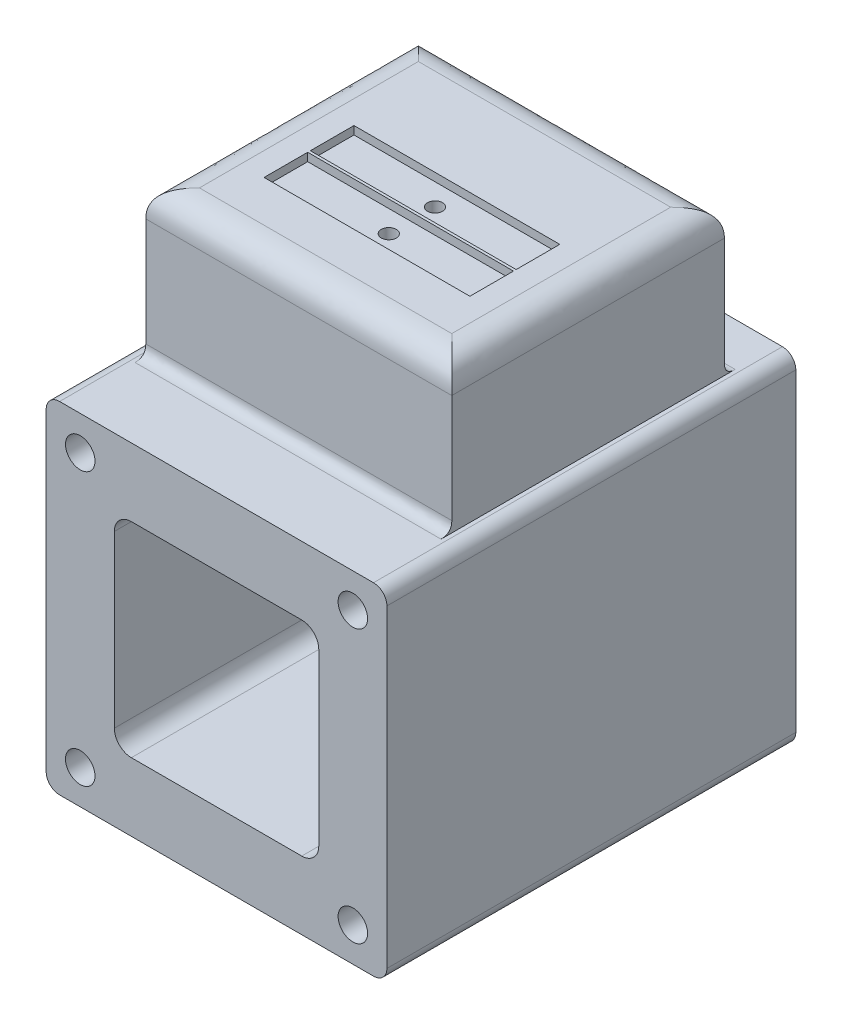
from build123d import *

# Parameters (mm, degrees)
SKETCH1_W                = 63.5
SKETCH1_H                = 63.5
BOSS_EXTRUDE1_DEPTH      = 76.2
M5_CLEARANCE_HOLE1_D     = 5.5
SKETCH4_W                = 38.1
SKETCH4_H                = 38.1
CUT_EXTRUDE1_DEPTH       = 89.44526556
FILLET1_R                = 2.5
FILLET2_R                = 3.175
SKETCH5_W                = 57.027431562
SKETCH5_H                = 50.8
BOSS_EXTRUDE2_DEPTH      = 27.178
SKETCH7_W                = 38.354
SKETCH7_H                = 8.128
CUT_EXTRUDE2_DEPTH       = 1.524
M3_CLEARANCE_HOLE1_D     = 2.8
M3_CLEARANCE_HOLE1_DEPTH = 38.354
FILLET3_SIZE             = 5
FILLET4_SIZE             = 2
FILLET5_SIZE             = 2


with BuildPart() as part:
    # Sketch1 → Boss-Extrude1 (new body)
    with BuildSketch(Plane.XY):
        Rectangle(SKETCH1_W, SKETCH1_H)
    extrude(amount=BOSS_EXTRUDE1_DEPTH)

    # M5 Clearance Hole1 (through all)
    with Locations(Plane.XY.offset(76.2)):
        with Locations((25.4, -25.4), (25.4, 25.4), (-25.4, -25.4), (-25.4, 25.4)):
            Hole(M5_CLEARANCE_HOLE1_D / 2)

    # Sketch4 → Cut-Extrude1 (cut, through all)
    with BuildSketch(Plane(origin=(0, 0, 0), x_dir=(-1, 0, 0), z_dir=(0, 0, -1))):
        Rectangle(SKETCH4_W, SKETCH4_H)
    extrude(amount=-CUT_EXTRUDE1_DEPTH, mode=Mode.SUBTRACT)

    # Fillet1
    fillet1_edges = [part.edges().sort_by_distance(p)[0] for p in [
        (31.75, -31.75, 38.1),
        (-31.75, -31.75, 38.1),
        (-31.75, 31.75, 38.1),
        (31.75, 31.75, 38.1),
    ]]
    fillet(fillet1_edges, radius=FILLET1_R)

    # Fillet2
    fillet2_edges = [part.edges().sort_by_distance(p)[0] for p in [
        (19.05, -19.05, 38.1),
        (19.05, 19.05, 38.1),
        (-19.05, 19.05, 38.1),
        (-19.05, -19.05, 38.1),
    ]]
    fillet(fillet2_edges, radius=FILLET2_R)

    # Sketch5 → Boss-Extrude2 (add)
    with BuildSketch(Plane(origin=(0, 31.75, 0), x_dir=(1, 0, 0), z_dir=(0, 1, 0))):
        with Locations((0, -35.47764662)):
            Rectangle(SKETCH5_W, SKETCH5_H)
    extrude(amount=BOSS_EXTRUDE2_DEPTH)

    # Sketch7 → Cut-Extrude2 (cut)
    with BuildSketch(Plane(origin=(0, 58.928, 0), x_dir=(1, 0, 0), z_dir=(0, 1, 0))):
        with Locations((-274.796433557, 103.138535486)):
            Rectangle(SKETCH7_W, SKETCH7_H)
        with Locations((0, -35.47764662)):
            Rectangle(SKETCH7_W, SKETCH7_H)
        with Locations((0, -44.101274776)):
            Rectangle(SKETCH7_W, SKETCH7_H)
    extrude(amount=-CUT_EXTRUDE2_DEPTH, mode=Mode.SUBTRACT)

    # M3 Clearance Hole1
    with Locations(Plane(origin=(0, 57.404, 0), x_dir=(1, 0, 0), z_dir=(0, 1, 0))):
        with Locations((0, -44.101274776), (0, -35.47764662)):
            Hole(M3_CLEARANCE_HOLE1_D / 2, depth=M3_CLEARANCE_HOLE1_DEPTH)

    # Fillet3
    # a fillet whose section is not a circle: 5 mm, written as the material it takes off along each edge
    with BuildSketch(Plane(origin=(-41.013715781, 58.928, 10.07764662), x_dir=(0, -1, 0), z_dir=(1, 0, 0)), Plane(origin=(41.013715781, 58.928, 60.87764662), x_dir=(0, -1, 0), z_dir=(-1, 0, 0))) as fillet3_piece_1:
        with BuildLine():
            Bezier((FILLET3_SIZE, 0), (0, 0), (0, -FILLET3_SIZE), weights=[1, 1, 1])
            Line((0, -FILLET3_SIZE), (0, 0))
            Line((0, 0), (FILLET3_SIZE, 0))
        make_face()
    extrude(amount=82.027431561, mode=Mode.SUBTRACT)
    with BuildSketch(Plane(origin=(28.513715781, 58.928, -2.42235338), x_dir=(0, -1, 0), z_dir=(0, 0, 1)), Plane(origin=(-28.513715781, 58.928, 73.37764662), x_dir=(0, -1, 0), z_dir=(0, 0, -1))) as fillet3_piece_2:
        with BuildLine():
            Bezier((FILLET3_SIZE, 0), (0, 0), (0, -FILLET3_SIZE), weights=[1, 1, 1])
            Line((0, -FILLET3_SIZE), (0, 0))
            Line((0, 0), (FILLET3_SIZE, 0))
        make_face()
    extrude(amount=75.8, mode=Mode.SUBTRACT)

    # Fillet4
    # a fillet whose section is not a circle: 2 mm, written as the material it adds along each edge
    with BuildSketch(Plane(origin=(28.513715781, 31.75, 60.87764662), x_dir=(0, 0, 1), z_dir=(-1, 0, 0))) as fillet4_piece_1:
        with BuildLine():
            Bezier((FILLET4_SIZE, 0), (0, 0), (0, FILLET4_SIZE), weights=[1, 1, 1])
            Line((0, FILLET4_SIZE), (0, 0))
            Line((0, 0), (FILLET4_SIZE, 0))
        make_face()
    extrude(amount=57.027431561)

    # Fillet5
    # a fillet whose section is not a circle: 2 mm, written as the material it adds along each edge
    with BuildSketch(Plane(origin=(-28.513715781, 31.75, 10.07764662), x_dir=(0, 1, 0), z_dir=(1, 0, 0))) as fillet5_piece_1:
        with BuildLine():
            Bezier((FILLET5_SIZE, 0), (0, 0), (0, -FILLET5_SIZE), weights=[1, 1, 1])
            Line((0, -FILLET5_SIZE), (0, 0))
            Line((0, 0), (FILLET5_SIZE, 0))
        make_face()
    extrude(amount=57.027431561)


solid = part.part
